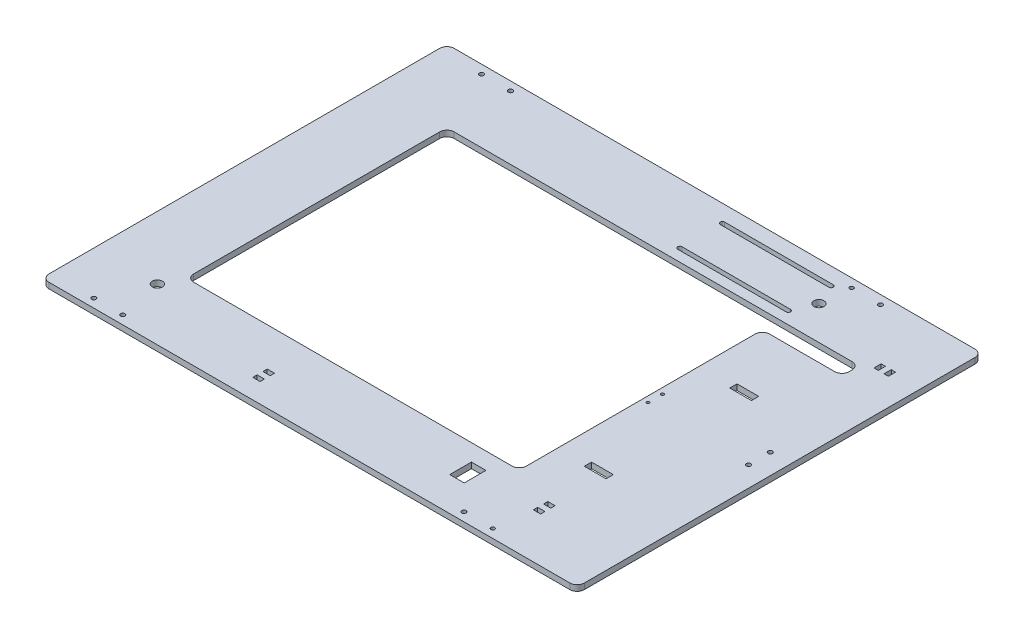
from build123d import *

# Parameters (mm, degrees)
SKETCH1_W           = 370
SKETCH1_H           = 280
SKETCH1_R           = 1.5
SKETCH1_R_2         = 1.569181713
SKETCH1_R_3         = 1.357318829
SKETCH1_R_4         = 1.322467774
SKETCH1_R_5         = 1
SKETCH1_W_2         = 230
SKETCH1_H_2         = 180
BOSS_EXTRUDE1_DEPTH = 4
SKETCH2_W           = 55
SKETCH2_H           = 12
CUT_EXTRUDE1_DEPTH  = 10
SKETCH3_R           = 1.5
CUT_EXTRUDE2_DEPTH  = 10
CUT_EXTRUDE3_DEPTH  = 10
FILLET3_R           = 5
FILLET4_R           = 5
FILLET5_R           = 5
FILLET6_R           = 5
FILLET7_R           = 5
FILLET8_R           = 5
FILLET9_R           = 5
SKETCH6_R           = 3.5
CUT_EXTRUDE4_DEPTH  = 10
SKETCH7_R           = 3.5
CUT_EXTRUDE5_DEPTH  = 10
SKETCH8_W           = 5
SKETCH8_H           = 3
SKETCH8_W_2         = 10
SKETCH8_H_2         = 15
SKETCH8_W_3         = 15
SKETCH8_H_3         = 5
SKETCH8_W_4         = 3
CUT_EXTRUDE6_DEPTH  = 10


with BuildPart() as part:
    # Sketch1 → Boss-Extrude1 (new body)
    with BuildSketch(Plane(origin=(0, 0, 0), x_dir=(1, 0, 0), z_dir=(0, 1, 0))):
        with Locations((185, 140)):
            Rectangle(SKETCH1_W, SKETCH1_H)
        with Locations((30, 274)):
            Circle(SKETCH1_R, mode=Mode.SUBTRACT)
        with Locations((50, 274)):
            Circle(SKETCH1_R_2, mode=Mode.SUBTRACT)
        with Locations((30, 6)):
            Circle(SKETCH1_R, mode=Mode.SUBTRACT)
        with Locations((50, 6)):
            Circle(SKETCH1_R, mode=Mode.SUBTRACT)
        with Locations((285.756924446, 273.985388104)):
            Circle(SKETCH1_R_3, mode=Mode.SUBTRACT)
        with Locations((305.756860025, 273.934625414)):
            Circle(SKETCH1_R, mode=Mode.SUBTRACT)
        with Locations((285.756860726, 6.001523901)):
            Circle(SKETCH1_R, mode=Mode.SUBTRACT)
        with Locations((305.756860025, 6.006818111)):
            Circle(SKETCH1_R_4, mode=Mode.SUBTRACT)
        with Locations((284, 145)):
            Circle(SKETCH1_R_5, mode=Mode.SUBTRACT)
        with Locations((284, 135)):
            Circle(SKETCH1_R_5, mode=Mode.SUBTRACT)
        with Locations((165, 140)):
            Rectangle(SKETCH1_W_2, SKETCH1_H_2, mode=Mode.SUBTRACT)
    extrude(amount=BOSS_EXTRUDE1_DEPTH)

    # Sketch2 → Cut-Extrude1 (cut)
    with BuildSketch(Plane(origin=(0, 4, 0), x_dir=(1, 0, 0), z_dir=(0, 1, 0))):
        with Locations((307.5, 224)):
            Rectangle(SKETCH2_W, SKETCH2_H)
    extrude(amount=-CUT_EXTRUDE1_DEPTH, mode=Mode.SUBTRACT)

    # Sketch3 → Cut-Extrude2 (cut)
    with BuildSketch(Plane(origin=(0, 4, 0), x_dir=(1, 0, 0), z_dir=(0, 1, 0))):
        with Locations((356, 147.5)):
            Circle(SKETCH3_R)
        with Locations((356, 132.5)):
            Circle(SKETCH3_R)
    extrude(amount=-CUT_EXTRUDE2_DEPTH, mode=Mode.SUBTRACT)

    # Sketch4 → Cut-Extrude3 (cut)
    with BuildSketch(Plane(origin=(0, 4, 0), x_dir=(1, 0, 0), z_dir=(0, 1, 0))):
        with BuildLine():
            Line((277.5, 266.5), (202.5, 266.5))
            ThreePointArc((202.5, 266.5), (201, 268), (202.5, 269.5))
            Line((202.5, 269.5), (277.5, 269.5))
            ThreePointArc((277.5, 269.5), (279, 268), (277.5, 266.5))
        make_face()
        with BuildLine():
            Line((277.5, 237), (202.5, 237))
            ThreePointArc((202.5, 237), (201, 238.5), (202.5, 240))
            Line((202.5, 240), (277.5, 240))
            ThreePointArc((277.5, 240), (279, 238.5), (277.5, 237))
        make_face()
    extrude(amount=-CUT_EXTRUDE3_DEPTH, mode=Mode.SUBTRACT)

    # Fillet3
    fillet3_edges = [part.edges().sort_by_distance(p)[0] for p in [
        (370, 2, 0),
    ]]
    fillet(fillet3_edges, radius=FILLET3_R)

    # Fillet4
    fillet4_edges = [part.edges().sort_by_distance(p)[0] for p in [
        (370, 2, -280),
    ]]
    fillet(fillet4_edges, radius=FILLET4_R)

    # Fillet5
    fillet5_edges = [part.edges().sort_by_distance(p)[0] for p in [
        (0, 2, 0),
    ]]
    fillet(fillet5_edges, radius=FILLET5_R)

    # Fillet6
    fillet6_edges = [part.edges().sort_by_distance(p)[0] for p in [
        (0, 2, -280),
    ]]
    fillet(fillet6_edges, radius=FILLET6_R)

    # Fillet7
    fillet7_edges = [part.edges().sort_by_distance(p)[0] for p in [
        (280, 2, -218),
    ]]
    fillet(fillet7_edges, radius=FILLET7_R)

    # Fillet8
    fillet8_edges = [part.edges().sort_by_distance(p)[0] for p in [
        (280, 2, -50),
    ]]
    fillet(fillet8_edges, radius=FILLET8_R)

    # Fillet9
    fillet9_edges = [part.edges().sort_by_distance(p)[0] for p in [
        (335, 2, -218),
        (335, 2, -230),
        (50, 2, -230),
        (50, 2, -50),
    ]]
    fillet(fillet9_edges, radius=FILLET9_R)

    # Sketch6 → Cut-Extrude4 (cut)
    with BuildSketch(Plane.XZ):
        with Locations((283.852252581, -253.25)):
            Circle(SKETCH6_R)
    extrude(amount=-CUT_EXTRUDE4_DEPTH, mode=Mode.SUBTRACT)

    # Sketch7 → Cut-Extrude5 (cut)
    with BuildSketch(Plane.XZ):
        with Locations((43.528330195, -36.357190156)):
            Circle(SKETCH7_R)
    extrude(amount=-CUT_EXTRUDE5_DEPTH, mode=Mode.SUBTRACT)

    # Sketch8 → Cut-Extrude6 (cut)
    with BuildSketch(Plane.XZ):
        with Locations((134.85877855, -14.984967273)):
            Rectangle(SKETCH8_W, SKETCH8_H)
        with Locations((134.85877855, -21.984967273)):
            Rectangle(SKETCH8_W, SKETCH8_H)
        with Locations((263.601107072, -30.863134191)):
            Rectangle(SKETCH8_W_2, SKETCH8_H_2)
        with Locations((311.102535039, -32.659137944)):
            Rectangle(SKETCH8_W, SKETCH8_H)
        with Locations((311.102535039, -39.659137944)):
            Rectangle(SKETCH8_W, SKETCH8_H)
        with Locations((307.626119627, -77.359497152)):
            Rectangle(SKETCH8_W_3, SKETCH8_H_3)
        with Locations((342.859262651, -236.259221691)):
            Rectangle(SKETCH8_W_4, SKETCH8_H_3)
        with Locations((349.859262651, -236.259221691)):
            Rectangle(SKETCH8_W_4, SKETCH8_H_3)
        with Locations((311.053880499, -174.438404524)):
            Rectangle(SKETCH8_W_3, SKETCH8_H_3)
    extrude(amount=-CUT_EXTRUDE6_DEPTH, mode=Mode.SUBTRACT)


solid = part.part
